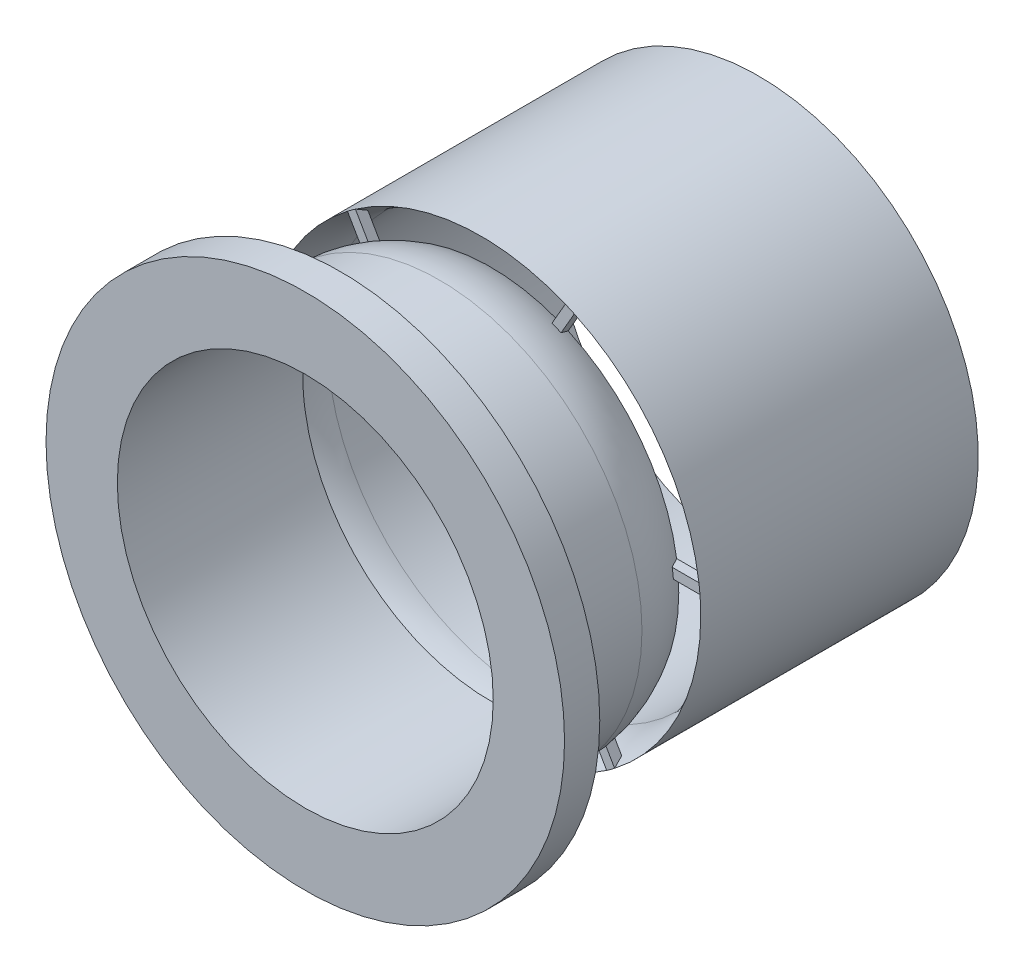
from build123d import *

# Parameters (mm, degrees)
SKETCH2_W           = 1.5
SKETCH2_H           = 28.42
FILLET1_R           = 10
FILLET2_R           = 10
BOSS_EXTRUDE4_START = -11.350833333
BOSS_EXTRUDE4_DEPTH = 1
CIRPATTERN2_COUNT   = 6


with BuildPart() as part:
    # Sketch2 → Revolve1 (revolve)
    with BuildSketch(Plane(origin=(0, 0, 0), x_dir=(1, 0, 0), z_dir=(0, 1, 0))):
        with Locations((-5.020833333, 24.560833333)):
            Rectangle(SKETCH2_W, SKETCH2_H)
        with BuildLine():
            Line((-2.520833333, 11.350833333), (-4.020833333, 11.350833333))
            Line((-4.020833333, 11.350833333), (-4.020833333, -3.645335915))
            ThreePointArc((-4.020833333, -3.645335915), (-4.014018155, -3.844339123), (-4.020833333, -4.043342332))
            Line((-4.020833333, -4.043342332), (-4.020833333, -5.649166667))
            Line((-4.020833333, -5.649166667), (-2.520833333, -5.649166667))
            Line((-2.520833333, -5.649166667), (-2.520833333, 11.350833333))
        make_face()
        with BuildLine():
            Line((-2.520833333, -7.649166667), (-2.520833333, -5.649166667))
            Line((-2.520833333, -5.649166667), (-4.020833333, -5.649166667))
            Line((-4.020833333, -5.649166667), (-4.641637876, -5.649166667))
            ThreePointArc((-4.641637876, -5.649166667), (-6.922872715, -6.753193683), (-9.204107554, -5.649166667))
            Line((-9.204107554, -5.649166667), (-9.824912097, -5.649166667))
            Line((-9.824912097, -5.649166667), (-9.824912097, -7.649166667))
            Line((-9.824912097, -7.649166667), (-2.520833333, -7.649166667))
        make_face()
        with BuildLine():
            Line((-4.020833333, -5.649166667), (-4.020833333, -4.043342332))
            ThreePointArc((-4.020833333, -4.043342332), (-4.209710195, -4.893235682), (-4.641637876, -5.649166667))
            Line((-4.641637876, -5.649166667), (-4.020833333, -5.649166667))
        make_face()
        with BuildLine():
            Line((-9.824912097, -5.649166667), (-9.204107554, -5.649166667))
            ThreePointArc((-9.204107554, -5.649166667), (-9.636035235, -4.893235682), (-9.824912097, -4.043342332))
            Line((-9.824912097, -4.043342332), (-9.824912097, -5.649166667))
        make_face()
    revolve(axis=Axis((16.729166667, 0, -8.305777899), (0, 0, 1)))

    # Fillet1
    # the kernel refuses this fillet: 10 mm, written as the material it takes off along each edge
    with BuildSketch(Plane(origin=(16.729166667, 0, -10.350833333), x_dir=(-1, 0, 0), z_dir=(0, 1, 0))) as fillet1_piece_1:
        with BuildLine():
            CenterArc((31, -5.267826876), FILLET1_R, 148.211669383, 31.788330617)
            Line((22.5, 0), (22.33, 0.105356538))
            ThreePointArc((22.33, 0.105356538), (21.75, 0.2), (21, 0.2))
            Line((21, 0.2), (20.8, 0))
            Line((20.8, 0), (20.8, -5.267826876))
            Line((20.8, -5.267826876), (21, -5.267826876))
        make_face()
    revolve(axis=Axis((16.729166667, 0, -10.350833333), (0, 0, 1)), mode=Mode.SUBTRACT)

    # Fillet2
    # the kernel refuses this fillet: 10 mm, written as the material it takes off along each edge
    with BuildSketch(Plane(origin=(16.729166667, 0, -11.350833333), x_dir=(-1, 0, 0), z_dir=(0, 1, 0))) as fillet2_piece_1:
        with BuildLine():
            CenterArc((10.75, 5.267826876), FILLET2_R, 328.211669383, 31.788330617)
            Line((19.25, 0), (19.42, -0.105356538))
            ThreePointArc((19.42, -0.105356538), (20, -0.2), (20.75, -0.2))
            Line((20.75, -0.2), (20.95, 0))
            Line((20.95, 0), (20.95, 5.267826876))
            Line((20.95, 5.267826876), (20.75, 5.267826876))
        make_face()
    revolve(axis=Axis((16.729166667, 0, -11.350833333), (0, 0, 1)), mode=Mode.SUBTRACT)

    # Boss-Extrude4: read off the stored shape, not the designer's step
    # Boss-Extrude4 outline → Boss-Extrude4 (add)
    with BuildSketch(Plane.XY.offset(BOSS_EXTRUDE4_START)):
        with BuildLine():
            ThreePointArc((39.147683304, 1.913141856), (39.09932169, 2.413744857), (39.039783075, 2.913141856))
            Line((39.039783075, 2.913141856), (35.757464135, 2.913141856))
            ThreePointArc((35.757464135, 2.913141856), (35.827209818, 2.4139693), (35.883862912, 1.913141856))
            Line((35.883862912, 1.913141856), (39.147683304, 1.913141856))
        make_face()
    boss_extrude4 = extrude(amount=BOSS_EXTRUDE4_DEPTH)

    # CirPattern2: Boss-Extrude4 ×6 about axis
    cirpattern2_axis = Axis((16.729166667, 0, 0), (0, 0, 1))
    for i in range(1, CIRPATTERN2_COUNT):
        add(boss_extrude4.rotate(cirpattern2_axis, i * 360 / CIRPATTERN2_COUNT))


solid = part.part
